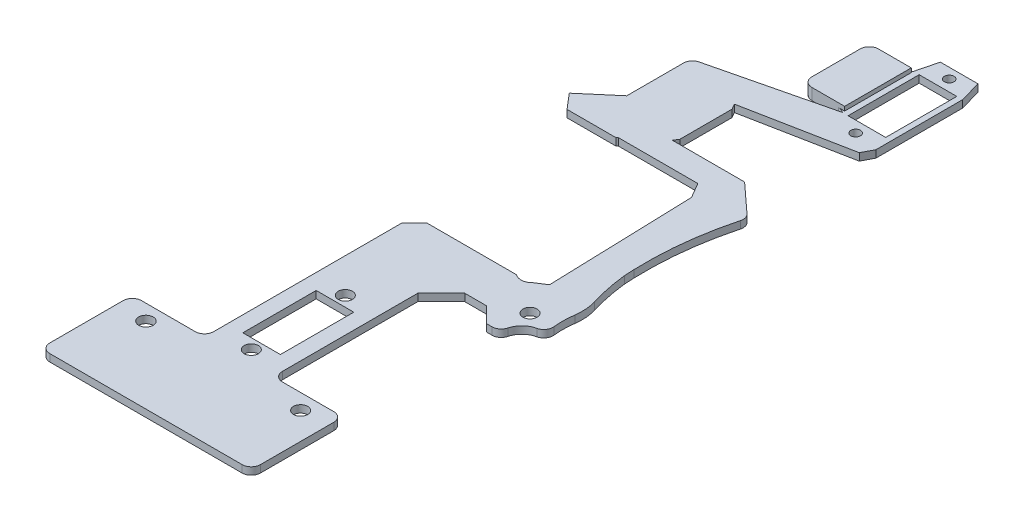
from build123d import *

# Parameters (mm, degrees)
SKETCH_1_R            = 1.55
SKETCH_1_R_2          = 1.05
SKETCH_1_R_3          = 1.581404189
SKETCH_1_W            = 8.2
SKETCH_1_H            = 15.5
SKETCH_1_H_2          = 16.001858204
EXTRUDE_1_DEPTH       = 1.6
SKETCH_1900_R         = 4.25
SKETCH_1900_R_2       = 2.5
CUT_EXTRUDE_5_DEPTH   = 85.317277267
EXTRUDE_3627_DEPTH    = 0.5
SKETCH_3_W            = 9.15
SKETCH_3_H            = 14.525
JST_GH_4PIN_X_2_DEPTH = 2.5
FILLET_3_R            = 2
EXTRUDE_START         = -1.6
EXTRUDE_5402_DEPTH    = 1.6


with BuildPart() as part:
    # 草图1 → 凸台-拉伸1 (new body)
    with BuildSketch(Plane(origin=(0, 0, 0), x_dir=(1, 0, 0), z_dir=(0, 1, 0))):
        Polygon((17.624917378, -7.723117708), (-4.691592189, -7.723117708), (-7.5, -10.531525519), (-7.5, -53.500834243), (-23.23198905, -53.500834243), (-23.23198905, -73.500834243), (22.7111878, -73.500834243), (22.7111878, -53.500834243), (7.5, -53.500834243), (7.5, -21.98577592), (12.62948765, -16.856288271), (17.315171978, -16.856288271), (20.682001416, -20.223117708), (26.774367048, -20.223117708), (29.820182402, -19.217148973), (29.820182402, 27.613551536), (22.124670003, 34.665102629), (18.4, 34.665102629), (6.35, 34.665102629), (7, 35.665102629), (7, 47.064038047), (6.331493599, 48.255532994), (29.1, 52.697797243), (30.35, 55.088888723), (30.35, 73.962756038), (29.042220737, 78.649353117), (20.842220737, 78.649353117), (19.65, 73.962756038), (19.65, 58.462756038), (-7, 52.009711353), (-7, 37.490925595), (0, 29.276882292), (17.314498575, 29.276882292), (19.254012403, 25.957144), (20.269436965, -6.007948815), align=None)
        with Locations(Location((0, -30.287243962, 0), (0, 0, 270))):
            Circle(SKETCH_1_R, mode=Mode.SUBTRACT)
        with Locations(Location((0, -50.787243962, 0), (0, 0, 270))):
            Circle(SKETCH_1_R, mode=Mode.SUBTRACT)
        with Locations(Location((25, 76.412756037, 0), (0, 0, 270))):
            Circle(SKETCH_1_R_2, mode=Mode.SUBTRACT)
        with Locations(Location((25, 56.012756039, 0), (0, 0, 270))):
            Circle(SKETCH_1_R_2, mode=Mode.SUBTRACT)
        with Locations(Location((23.5, -13.5, 0), (0, 0, 270))):
            Circle(SKETCH_1_R, mode=Mode.SUBTRACT)
        with Locations(Location((-16.865979253, -56.895287035, 0), (0, 0, 270))):
            Circle(SKETCH_1_R_3, mode=Mode.SUBTRACT)
        with Locations(Location((16.865979253, -56.895287035, 0), (0, 0, 270))):
            Circle(SKETCH_1_R, mode=Mode.SUBTRACT)
        with Locations((25, 66.212756038)):
            Rectangle(SKETCH_1_W, SKETCH_1_H, mode=Mode.SUBTRACT)
        with Locations((0, -40.536314862)):
            Rectangle(SKETCH_1_W, SKETCH_1_H_2, mode=Mode.SUBTRACT)
    extrude(amount=EXTRUDE_1_DEPTH)

    # Sketch 1900 → 切除-拉伸5 (cut, through all)
    with BuildSketch(Plane(origin=(0, 0, 0), x_dir=(1, 0, 0), z_dir=(0, 1, 0))):
        with BuildLine():
            ThreePointArc((32.25, -19.787243962), (31.591537652, -17.514941761), (29.820184804, -15.946745651))
            Line((29.820184804, -15.946745651), (29.820138471, -18.164164281))
            ThreePointArc((29.820138471, -18.164164281), (29.388960143, -16.929984913), (29.04688934, -15.668200055))
            ThreePointArc((29.04688934, -15.668200055), (24.645020142, -22.396192055), (32.25, -19.787243962))
        make_face()
        with BuildLine():
            Line((29.820138471, -18.164164281), (29.820184804, -15.946745651))
            ThreePointArc((29.820184804, -15.946745651), (29.440286586, -15.788734921), (29.04688934, -15.668200055))
            ThreePointArc((29.04688934, -15.668200055), (29.388960143, -16.929984913), (29.820138471, -18.164164281))
        make_face()
        with Locations((28, -19.787243962)):
            Circle(SKETCH_1900_R)
        with BuildLine():
            ThreePointArc((29.389676683, 28.446687445), (29.699958614, 29.863367854), (29.821172201, 31.308554874))
            Line((29.821172201, 31.308554874), (29.820138471, -18.164164281))
            ThreePointArc((29.820138471, -18.164164281), (28.692543787, -13.637691906), (28.744612063, -8.973175765))
            ThreePointArc((28.744612063, -8.973175765), (28.818369707, -6.611977276), (28.386269498, -4.289481227))
            ThreePointArc((28.386269498, -4.289481227), (27.36992989, -0.250862064), (26.720671038, 3.862756038))
            Line((26.720671038, 3.862756038), (26.610745663, 6.062756038))
            ThreePointArc((26.610745663, 6.062756038), (27.113818567, 17.364766035), (29.389676683, 28.446687445))
        make_face()
        with Locations((28, 36.212756038)):
            Circle(SKETCH_1900_R)
        with Locations((16.265283418, -5.723117708)):
            Circle(SKETCH_1900_R_2)
    extrude(amount=CUT_EXTRUDE_5_DEPTH, mode=Mode.SUBTRACT)

    # Sketch 2795 → Extrude 3627 (add)
    with BuildSketch(Plane(origin=(0, 0, 0), x_dir=(1, 0, 0), z_dir=(0, 1, 0))):
        Polygon((5.284716582, -7.723117708), (0.215283418, -7.723117708), (0.215283418, -19.223117708), (1.334716582, -19.223117708), (5.284716582, -15.273117708), align=None)
        Polygon((-0.215283418, -7.723117708), (-4.691592189, -7.723117708), (-5.284716582, -8.316242101), (-5.284716582, -19.223117708), (-0.215283418, -19.223117708), align=None)
    extrude(amount=-EXTRUDE_3627_DEPTH)

    # Sketch 3 → JST-GH-4Pin x 2 (add)
    with BuildSketch(Plane(origin=(0, 0, 0), x_dir=(1, 0, 0), z_dir=(0, 1, 0))):
        with Locations((15.075, 66.225256038)):
            Rectangle(SKETCH_3_W, SKETCH_3_H)
    extrude(amount=JST_GH_4PIN_X_2_DEPTH)

    # 圆角3
    # the kernel refuses this fillet: 2 mm, written as the material it adds along each edge
    with BuildSketch(Plane(origin=(19.65, 0, -58.962756038), x_dir=(0, 0, 1), z_dir=(0, 1, 0))) as fillet_3_piece_1:
        with BuildLine():
            CenterArc((2, -1.322875656), FILLET_3_R, 138.590377891, 41.409622109)
            Line((0, -1.322875656), (0, 0))
            Line((0, 0), (0.5, 0))
        make_face()
    extrude(amount=1.6)
    with BuildSketch(Plane(origin=(19.65, 0, -73.487756038), x_dir=(0, 0, -1), z_dir=(0, 1, 0))) as fillet_3_piece_2:
        with BuildLine():
            CenterArc((2, 1.293976429), FILLET_3_R, 180, 40.314909173)
            Line((0, 1.293976429), (0, 0))
            Line((0, 0), (0.475, 0))
        make_face()
    extrude(amount=1.6)
    with BuildSketch(Plane(origin=(7.5, 0, 53.500834243), x_dir=(0, 0, -1), z_dir=(0, 1, 0)), Plane(origin=(-7.5, 0, 53.500834243), x_dir=(-1, 0, 0), z_dir=(0, 1, 0))) as fillet_3_piece_3:
        with BuildLine():
            CenterArc((FILLET_3_R, -FILLET_3_R), FILLET_3_R, 90, 90)
            Line((0, -FILLET_3_R), (0, 0))
            Line((0, 0), (FILLET_3_R, 0))
        make_face()
    extrude(amount=1.6)
    # the kernel refuses this fillet: 2 mm, written as the material it takes off along each edge
    with BuildSketch(Plane(origin=(10.5, -5, -58.962756038), x_dir=(0, 0, -1), z_dir=(0, 1, 0)), Plane(origin=(10.5, -5, -73.487756038), x_dir=(1, 0, 0), z_dir=(0, 1, 0))) as fillet_3_2_piece_1:
        with BuildLine():
            CenterArc((FILLET_3_R, -FILLET_3_R), FILLET_3_R, 90, 90)
            Line((0, -FILLET_3_R), (0, 0))
            Line((0, 0), (FILLET_3_R, 0))
        make_face()
    extrude(amount=12.5, mode=Mode.SUBTRACT)
    with BuildSketch(Plane(origin=(-7, -3.933789701, -52.009711353), x_dir=(0.9719132109472551, 0, -0.23533956400528205), z_dir=(0, 1, 0))) as fillet_3_2_piece_2:
        with BuildLine():
            CenterArc((FILLET_3_R * 0.786757940299, -FILLET_3_R), FILLET_3_R, 90, 76.388360252)
            Line((-FILLET_3_R * 0.185155270648, -FILLET_3_R * 0.764660435995), (0, 0))
            Line((0, 0), (FILLET_3_R * 0.786757940299, 0))
        make_face()
    extrude(amount=9.467579403, mode=Mode.SUBTRACT)
    with BuildSketch(Plane(origin=(23.77241037, 6.158816797, 20.223117708), x_dir=(-1, 0, 0), z_dir=(0, -1, 0))) as fillet_3_2_piece_3:
        with BuildLine():
            CenterArc((1.823526719, 2), FILLET_3_R, 194.492910043, 75.507089957)
            ThreePointArc((-0.112830513, 1.499479599), (0.010429415, 0.754769623), (0, 0))
            Line((0, 0), (1.823526719, 0))
        make_face()
    extrude(amount=10.717633594, mode=Mode.SUBTRACT)
    with BuildSketch(Plane(origin=(-23.23198905, -5, 73.500834243), x_dir=(0, 0, -1), z_dir=(0, 1, 0)), Plane(origin=(22.7111878, -5, 73.500834243), x_dir=(-1, 0, 0), z_dir=(0, 1, 0)), Plane(origin=(22.7111878, -5, 53.500834243), x_dir=(0, 0, 1), z_dir=(0, 1, 0)), Plane(origin=(-23.23198905, -5, 53.500834243), x_dir=(1, 0, 0), z_dir=(0, 1, 0))) as fillet_3_2_piece_4:
        with BuildLine():
            CenterArc((FILLET_3_R, -FILLET_3_R), FILLET_3_R, 90, 90)
            Line((0, -FILLET_3_R), (0, 0))
            Line((0, 0), (FILLET_3_R, 0))
        make_face()
    extrude(amount=11.6, mode=Mode.SUBTRACT)
    with BuildSketch(Plane(origin=(29.290123585, 4.655582445, -28.099254974), x_dir=(-0.26492584299558386, 0, 0.9642687891418446), z_dir=(0, -1, 0))) as fillet_3_2_piece_5:
        with BuildLine():
            CenterArc((1.222348791, 1.99992922), FILLET_3_R, 207.137102211, 62.380861619)
            Line((-0.557486463, 1.087686672), (0, 0))
            ThreePointArc((0, 0), (0.602761377, 0.002535566), (1.205522753, 0))
        make_face()
    extrude(amount=7.71116489, mode=Mode.SUBTRACT)
    with BuildSketch(Plane(origin=(29.04688934, 7.189707678, 15.668200055), x_dir=(-0.9998305759549154, 0, -0.018407047173896997), z_dir=(0, -1, 0))) as fillet_3_2_piece_6:
        with BuildLine():
            CenterArc((2.398675677, 1.947113498), FILLET_3_R, 172.818157219, 83.976285302)
            ThreePointArc((0.414366937, 2.197151144), (0.240731561, 1.092248642), (0, 0))
            ThreePointArc((0, 0), (0.970892536, 0.112383816), (1.941785072, 0))
        make_face()
    extrude(amount=12.779415356, mode=Mode.SUBTRACT)

    # Sketch 3 2 → Extrude 5402 (add)
    with BuildSketch(Plane(origin=(0, 1.6, 0), x_dir=(1, 0, 0), z_dir=(0, 1, 0)).offset(EXTRUDE_START)):
        Polygon((-13.766428784, 32.326134419), (-10.943503558, 29.013615841), (-0.308926004, 29.013615841), (0, 29.276882292), (-7, 37.490925595), (-7, 38.092478683), align=None)
    extrude(amount=EXTRUDE_5402_DEPTH)


solid = part.part
